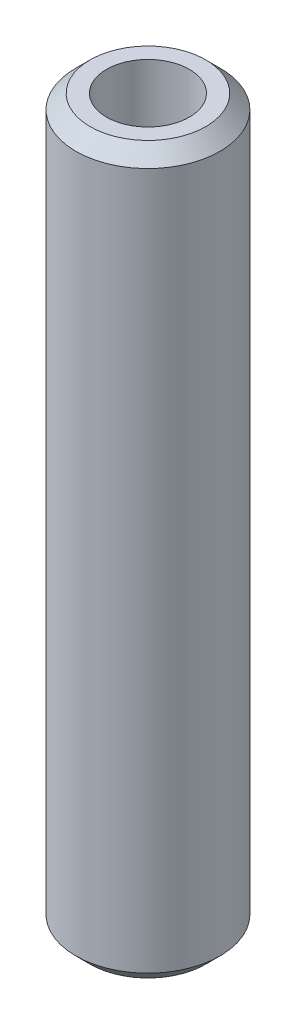
from build123d import *

# Parameters (mm, degrees)
SKETCH1_R           = 22.5
BOSS_EXTRUDE1_DEPTH = 226.309533307
SKETCH2_R           = 12.921095508
CUT_EXTRUDE1_DEPTH  = 229.535565866
CHAMFER1_SIZE       = 4.44893719


with BuildPart() as part:
    # Sketch1 → Boss-Extrude1 (new body)
    with BuildSketch(Plane(origin=(0, 0, 0), x_dir=(1, 0, 0), z_dir=(0, 1, 0))):
        Circle(SKETCH1_R)
    extrude(amount=BOSS_EXTRUDE1_DEPTH)

    # Sketch2 → Cut-Extrude1 (cut, through all)
    with BuildSketch(Plane(origin=(0, 0, 0), x_dir=(1, 0, 0), z_dir=(0, 1, 0))):
        Circle(SKETCH2_R)
    extrude(amount=CUT_EXTRUDE1_DEPTH, mode=Mode.SUBTRACT)

    # Chamfer1
    chamfer1_edges = [part.edges().sort_by_distance(p)[0] for p in [
        (-22.5, 226.309533307, 0),
        (-22.5, 0, 0),
    ]]
    chamfer(chamfer1_edges, length=CHAMFER1_SIZE)


solid = part.part
